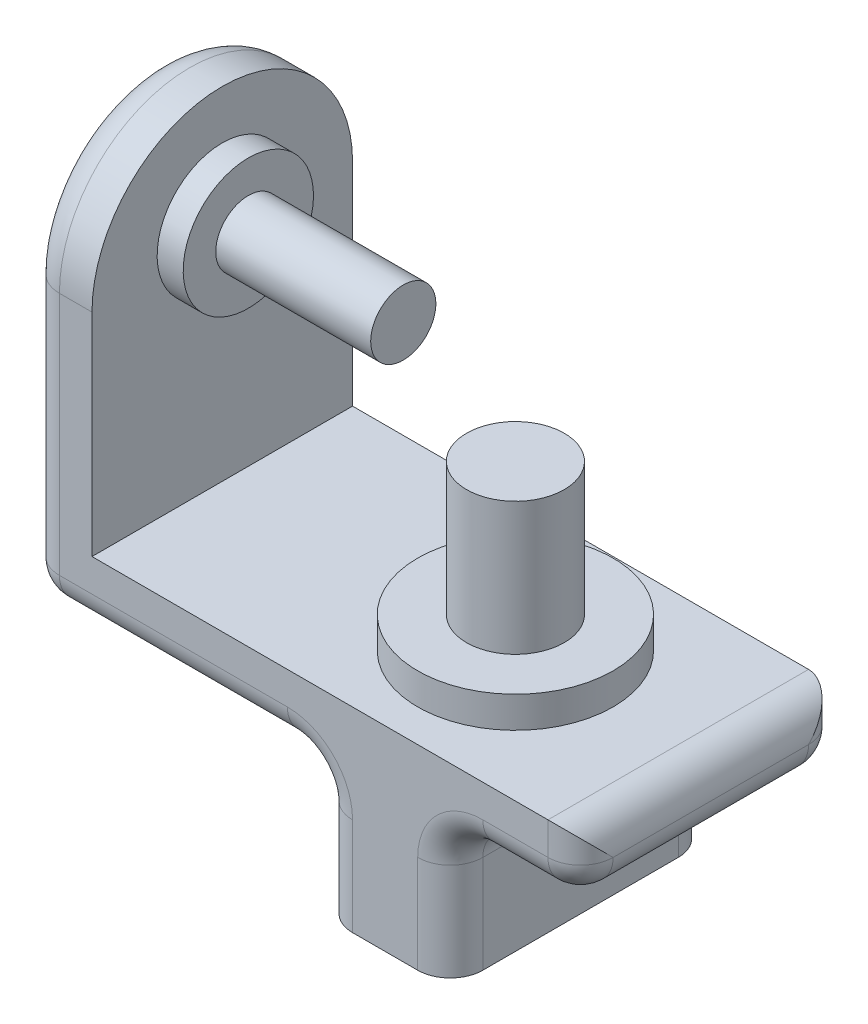
from build123d import *

# Parameters (mm, degrees)
SKETCH1_W           = 200
SKETCH1_H           = 200
BOSS_EXTRUDE1_DEPTH = 200
FILLET1_RADIUS      = 200
FILLET1_LENGTH      = 100
FILLET5_R           = 50
SKETCH2_R           = 150
SKETCH2_R_2         = 75
BOSS_EXTRUDE2_DEPTH = 48
SKETCH2_2_R         = 75
BOSS_EXTRUDE3_DEPTH = 251.487133837
SKETCH3_R           = 100
SKETCH3_R_2         = 50
BOSS_EXTRUDE4_DEPTH = 40
SKETCH3_4_R         = 50
BOSS_EXTRUDE5_DEPTH = 277.840021082
WRAP2_OUTLINE_W     = 3.419230769
WRAP2_OUTLINE_H     = 19.05
WRAP2_DEPTH         = 3


# Read off the part's stored shape, not the designer's step: Wrap2
with BuildPart() as part:
    # Sketch1 → Boss-Extrude1 (new, symmetric)
    with BuildSketch(Plane.XY):
        Polygon((-450.000101236, 475), (-450.000101236, -50), (299.999898764, -50), (299.999898764, -150), (-550.000101236, -150), (-550.000101236, 475), align=None)
        with Locations((0, -250)):
            Rectangle(SKETCH1_W, SKETCH1_H)
    extrude(amount=BOSS_EXTRUDE1_DEPTH, both=True)

    # Fillet1: full round fillet: the end face becomes a half cylinder, R = half its width
    fillet1_face = Plane((-500.000101236, 475, 0), x_dir=(1, 0, 0), z_dir=(0, 1, 0))  # on the end face: x along it, z out of the body
    fillet1_slab = fillet1_face.offset(-FILLET1_RADIUS / 2) * Box(FILLET1_LENGTH, 2 * FILLET1_RADIUS, FILLET1_RADIUS, mode=Mode.PRIVATE)  # the body's end, R deep
    fillet1_round = Plane((-500.000101236, 275, 0), x_dir=(0, 1, 0), z_dir=(1, 0, 0)) * Cylinder(FILLET1_RADIUS, FILLET1_LENGTH, mode=Mode.PRIVATE)  # its axis R under the face
    add(fillet1_slab - fillet1_round, mode=Mode.SUBTRACT)

    # Fillet5
    fillet5_edges = [part.edges().sort_by_distance(p)[0] for p in [
        (-100, -250, 200),
        (-550.000101236, -150, 0),
        (299.999898764, -150, 0),
        (299.999898764, -50, 0),
        (-550.000101236, 62.5, 200),
        (199.999949382, -150, 200),
        (-325.000050618, -150, 200),
        (299.999898764, -100, 200),
        (-550.000101236, 62.5, -200),
        (199.999949382, -150, -200),
        (-325.000050618, -150, -200),
        (299.999898764, -100, -200),
        (-550.000101236, 475, 0),
        (100, -250, 200),
        (-100, -250, -200),
        (100, -250, -200),
        (-100, -150, 0),
        (100, -150, 0),
    ]]
    fillet(fillet5_edges, radius=FILLET5_R - 0.0001)  # a hair under: the kernel refuses the full size

    # Sketch2 → Boss-Extrude2 (add)
    with BuildSketch(Plane(origin=(0, -50, 0), x_dir=(1, 0, 0), z_dir=(0, 1, 0))):
        with Locations(Location((0, 0, 0), (0, 0, 180))):
            Circle(SKETCH2_R)
        with Locations(Location((0, 0, 0), (0, 0, 180))):
            Circle(SKETCH2_R_2, mode=Mode.SUBTRACT)
    extrude(amount=BOSS_EXTRUDE2_DEPTH)

    # Sketch2<2> → Boss-Extrude3 (add)
    with BuildSketch(Plane(origin=(0, -50, 0), x_dir=(1, 0, 0), z_dir=(0, 1, 0))):
        Circle(SKETCH2_2_R)
    extrude(amount=BOSS_EXTRUDE3_DEPTH)

    # Sketch3 → Boss-Extrude4 (add)
    with BuildSketch(Plane(origin=(-450.000101236, 0, 0), x_dir=(0, 0, -1), z_dir=(1, 0, 0))):
        with Locations(Location((0, 300.000101172, 0), (0, 0, 90))):
            Circle(SKETCH3_R)
        with Locations(Location((0, 300.000101172, 0), (0, 0, 90))):
            Circle(SKETCH3_R_2, mode=Mode.SUBTRACT)
    extrude(amount=BOSS_EXTRUDE4_DEPTH)

    # Sketch3<4> → Boss-Extrude5 (add)
    with BuildSketch(Plane(origin=(-450.000101236, 0, 0), x_dir=(0, 0, -1), z_dir=(1, 0, 0))):
        with Locations(Location((0, 300.000101172, 0), (0, 0, 180))):
            Circle(SKETCH3_4_R)
    extrude(amount=BOSS_EXTRUDE5_DEPTH)

    # Wrap2 outline → Wrap2 (add)
    # profile 1 of 17: a face of its own
    with BuildSketch(Plane.ZY.offset(550.000101236)):
        with BuildLine():
            add(Edge.make_bspline(
                [(-82.804417139, 108.204415902), (-82.913939096, 108.358908009), (-83.124205981, 108.655511309), (-83.46502667, 109.05267012), (-83.804308379, 109.391476141), (-84.145194346, 109.670513999), (-84.490706056, 109.88808833), (-84.840243749, 110.042133359), (-85.1918258, 110.140061247), (-85.428034667, 110.152255625), (-85.544381081, 110.158262055)],
                knots=[0, 0, 0, 0, 0.162420307, 0.31182434, 0.448432767, 0.573381197, 0.689077147, 0.797572901, 0.900293043, 1, 1, 1, 1], degree=3))
            Line((-82.804417139, 108.204415902), (-80.247626274, 110.543688738))
            add(Edge.make_bspline(
                [(-85.506220024, 113.577492825), (-85.28176812, 113.569281896), (-84.834636057, 113.552924852), (-84.173538405, 113.425018117), (-83.527805859, 113.223871303), (-83.007462472, 112.981209802), (-82.593434952, 112.746143491), (-82.276121533, 112.529724042), (-81.95323805, 112.281803932), (-81.622180646, 112.001601899), (-81.289100883, 111.683838568), (-80.944527708, 111.336078546), (-80.593156353, 110.955316373), (-80.364820683, 110.683301642), (-80.247626274, 110.543688738)],
                knots=[0, 0, 0, 0, 0.10691022, 0.212976528, 0.319776676, 0.428556273, 0.485856803, 0.546558687, 0.611431498, 0.67982091, 0.753158505, 0.830752869, 0.913133075, 1, 1, 1, 1], degree=3))
            add(Edge.make_bspline(
                [(-90.505318581, 108.746302921), (-90.501186394, 108.909398801), (-90.493045542, 109.230715205), (-90.420427882, 109.70316416), (-90.311898022, 110.159037705), (-90.154281508, 110.596672605), (-89.949714303, 111.015520705), (-89.70127538, 111.417632443), (-89.405106952, 111.799306873), (-89.071345127, 112.160290973), (-88.703625049, 112.49018936), (-88.310669416, 112.781357742), (-87.89470239, 113.027282792), (-87.458268647, 113.231295478), (-86.99866379, 113.387454229), (-86.519273705, 113.498147335), (-86.019410796, 113.563984065), (-85.679414835, 113.572933805), (-85.506220024, 113.577492825)],
                knots=[0, 0, 0, 0, 0.06317288, 0.12445736, 0.184840915, 0.244566821, 0.304319173, 0.365199786, 0.427420983, 0.491261689, 0.555499002, 0.618604518, 0.680494764, 0.742473305, 0.804990665, 0.868251971, 0.932887217, 1, 1, 1, 1], degree=3))
            add(Edge.make_bspline(
                [(-85.704657524, 102.060485613), (-85.947131837, 102.265642133), (-86.412513435, 102.659399592), (-87.070156678, 103.240966963), (-87.662752124, 103.78449496), (-88.185181482, 104.296702776), (-88.644101312, 104.768131121), (-89.036403609, 105.202609116), (-89.357778753, 105.603488165), (-89.695956795, 106.078302572), (-90.017293549, 106.656896551), (-90.295019692, 107.353012183), (-90.475196692, 108.049039488), (-90.495383019, 108.516313884), (-90.505318581, 108.746302921)],
                knots=[0, 0, 0, 0, 0.112124581, 0.215201009, 0.309902452, 0.395959096, 0.473447494, 0.542140328, 0.602523333, 0.654726333, 0.747804055, 0.835278417, 0.918925243, 1, 1, 1, 1], degree=3))
            add(Edge.make_bspline(
                [(-83.178395504, 98.774818546), (-83.184668072, 98.883522), (-83.197410193, 99.104342662), (-83.291264731, 99.432667477), (-83.437988, 99.760842976), (-83.611571975, 100.0300214), (-83.788215404, 100.255397197), (-83.957126364, 100.45067513), (-84.162815232, 100.666423059), (-84.40476047, 100.902912379), (-84.679765351, 101.162224965), (-84.988061531, 101.444335425), (-85.333179327, 101.746758701), (-85.577109267, 101.952766449), (-85.704657524, 102.060485613)],
                knots=[0, 0, 0, 0, 0.076346606, 0.155090822, 0.238351561, 0.32840414, 0.37938386, 0.439617644, 0.509831416, 0.588874645, 0.677436354, 0.77554672, 0.882635872, 1, 1, 1, 1], degree=3))
            add(Edge.make_bspline(
                [(-85.353575793, 96.969800517), (-85.205317748, 96.975796453), (-84.917675547, 96.987429443), (-84.507103114, 97.094879864), (-84.130674762, 97.263584908), (-83.805292874, 97.50430374), (-83.529780007, 97.78212986), (-83.326435696, 98.091224121), (-83.198693429, 98.425656651), (-83.185187974, 98.657975485), (-83.178395504, 98.774818546)],
                knots=[0, 0, 0, 0, 0.141985893, 0.275473311, 0.404345843, 0.535429711, 0.661427401, 0.77786684, 0.888279749, 1, 1, 1, 1], degree=3))
            add(Edge.make_bspline(
                [(-88.475150312, 99.412108209), (-88.3641225, 99.219115306), (-88.151272695, 98.849131415), (-87.790578802, 98.352011166), (-87.421066322, 97.92630996), (-87.034192458, 97.579552096), (-86.634661452, 97.307100973), (-86.220543476, 97.112388499), (-85.791547579, 96.991861698), (-85.499335063, 96.977142592), (-85.353575793, 96.969800517)],
                knots=[0, 0, 0, 0, 0.160457921, 0.307611547, 0.442138888, 0.566229194, 0.681222208, 0.789558005, 0.895028892, 1, 1, 1, 1], degree=3))
            Line((-88.475150312, 99.412108209), (-91.482241658, 97.60709018))
            add(Edge.make_bspline(
                [(-85.479507283, 93.550569748), (-85.642435172, 93.553460197), (-85.965125831, 93.559184944), (-86.440723077, 93.605922741), (-86.899965981, 93.681352571), (-87.342337248, 93.789466051), (-87.769829838, 93.926460494), (-88.182461307, 94.093793957), (-88.577383123, 94.294060048), (-88.957583452, 94.523140498), (-89.321214052, 94.789133077), (-89.672872888, 95.086599652), (-90.00906695, 95.420115393), (-90.331410912, 95.788891547), (-90.637842325, 96.193972401), (-90.93839179, 96.629716454), (-91.219701984, 97.104210524), (-91.393479805, 97.437071952), (-91.482241658, 97.60709018)],
                knots=[0, 0, 0, 0, 0.063551482, 0.125868382, 0.18624025, 0.244976651, 0.303357688, 0.361230317, 0.418489049, 0.475936712, 0.534203744, 0.594059429, 0.655468694, 0.718771685, 0.784974607, 0.853522316, 0.925182451, 1, 1, 1, 1], degree=3))
            add(Edge.make_bspline(
                [(-79.759164735, 98.973256046), (-79.762574714, 98.780859638), (-79.769265218, 98.403370724), (-79.851211066, 97.850971929), (-79.968061036, 97.322302307), (-80.148731589, 96.823114532), (-80.368931788, 96.345214589), (-80.644984541, 95.896046638), (-80.969170648, 95.471064917), (-81.340737702, 95.077866494), (-81.751734985, 94.721066179), (-82.192568632, 94.403434111), (-82.667549336, 94.14118838), (-83.172618937, 93.925247726), (-83.707507081, 93.758927347), (-84.271576557, 93.636001086), (-84.865690147, 93.562222682), (-85.271953581, 93.554510025), (-85.479507283, 93.550569748)],
                knots=[0, 0, 0, 0, 0.065200875, 0.127926544, 0.18904691, 0.248543693, 0.307607127, 0.36724766, 0.426963056, 0.488617128, 0.550391855, 0.611330734, 0.672556085, 0.734024191, 0.797340621, 0.862249627, 0.929625466, 1, 1, 1, 1], degree=3))
            add(Edge.make_bspline(
                [(-81.728275312, 103.342697152), (-81.560093288, 103.160688182), (-81.236788375, 102.810803024), (-80.81660596, 102.268591067), (-80.470782241, 101.739281636), (-80.203246455, 101.212914918), (-80.001192668, 100.681896488), (-79.858742072, 100.133203148), (-79.773427462, 99.561101397), (-79.763955549, 99.170711791), (-79.759164735, 98.973256046)],
                knots=[0, 0, 0, 0, 0.150833097, 0.289954183, 0.417138648, 0.535255184, 0.648751095, 0.762405462, 0.879826701, 1, 1, 1, 1], degree=3))
            add(Edge.make_bspline(
                [(-84.182031322, 105.540774075), (-84.021784624, 105.402088641), (-83.717669685, 105.1388925), (-83.284974517, 104.765327838), (-82.90470753, 104.429240819), (-82.5713291, 104.135675392), (-82.28989292, 103.881551383), (-82.059215831, 103.665654082), (-81.876480502, 103.492186613), (-81.772606168, 103.387412156), (-81.728275312, 103.342697152)],
                knots=[0, 0, 0, 0, 0.192952702, 0.366184141, 0.520457298, 0.655012135, 0.770624226, 0.865677185, 0.942674527, 1, 1, 1, 1], degree=3))
            add(Edge.make_bspline(
                [(-86.769351033, 107.99834619), (-86.725540319, 107.943037227), (-86.62469384, 107.8157233), (-86.43240026, 107.614077884), (-86.190919909, 107.3670446), (-85.890960113, 107.083118197), (-85.54497303, 106.752087573), (-85.136921711, 106.386965666), (-84.678551652, 105.976445077), (-84.352752834, 105.690573404), (-84.182031322, 105.540774075)],
                knots=[0, 0, 0, 0, 0.059234189, 0.136349281, 0.233805212, 0.349411224, 0.48317915, 0.635966856, 0.809243356, 1, 1, 1, 1], degree=3))
            add(Edge.make_bspline(
                [(-87.086087812, 108.910395469), (-87.082722509, 108.831103994), (-87.075945257, 108.671421982), (-87.010486225, 108.437388107), (-86.911820772, 108.208709768), (-86.817541904, 108.069502381), (-86.769351033, 107.99834619)],
                knots=[0, 0, 0, 0, 0.241881375, 0.487115475, 0.73783784, 1, 1, 1, 1], degree=3))
            add(Edge.make_bspline(
                [(-85.544381081, 110.158262055), (-85.65290568, 110.154456105), (-85.862438166, 110.147107816), (-86.161142271, 110.074066366), (-86.426336029, 109.948007551), (-86.657760623, 109.783175044), (-86.841083045, 109.584590088), (-86.987451783, 109.37632553), (-87.069869682, 109.146448558), (-87.080717499, 108.98855978), (-87.086087812, 108.910395469)],
                knots=[0, 0, 0, 0, 0.148126258, 0.285992887, 0.416634394, 0.547379946, 0.671582838, 0.784400739, 0.893265576, 1, 1, 1, 1], degree=3))
        make_face()
    # profile 2 of 17: a face of its own
    with BuildSketch(Plane.ZY.offset(550.000101236)):
        with BuildLine():
            add(Edge.make_bspline(
                [(-54.202704399, 113.089031286), (-53.866816356, 113.086683314), (-53.217540973, 113.082144657), (-52.276869391, 113.031004906), (-51.402164523, 112.952355599), (-50.592862516, 112.844159224), (-49.85062257, 112.700985792), (-49.176401788, 112.521402782), (-48.567937325, 112.314104073), (-48.018557493, 112.070175077), (-47.517026547, 111.785778093), (-47.040806908, 111.468982685), (-46.590833621, 111.108183712), (-46.160792023, 110.710341704), (-45.756231892, 110.268178266), (-45.370415852, 109.789017224), (-45.012790432, 109.265910083), (-44.672545387, 108.711399303), (-44.364839019, 108.12313492), (-44.096446027, 107.506124118), (-43.87161159, 106.86433759), (-43.688921967, 106.19709136), (-43.543297253, 105.506600482), (-43.441406576, 104.79147161), (-43.378416744, 104.052366834), (-43.372026952, 103.551439237), (-43.36878012, 103.296903882)],
                knots=[0, 0, 0, 0, 0.060148162, 0.116267077, 0.168653955, 0.217398969, 0.262433523, 0.303932701, 0.342259967, 0.377441339, 0.411406099, 0.445398351, 0.479766387, 0.514584482, 0.550213651, 0.587000908, 0.624662987, 0.663615456, 0.703456428, 0.743450162, 0.784013386, 0.825132536, 0.867264663, 0.910306473, 0.954424205, 1, 1, 1, 1], degree=3))
            Line((-54.202704399, 113.089031286), (-58.511087812, 113.089031286))
            Line((-58.511087812, 113.089031286), (-58.511087812, 94.039031286))
            Line((-58.511087812, 94.039031286), (-54.137830601, 94.039031286))
            add(Edge.make_bspline(
                [(-43.36878012, 103.296903882), (-43.37728208, 102.937737928), (-43.394018685, 102.230698724), (-43.534998502, 101.193126837), (-43.763010601, 100.198510697), (-44.083616322, 99.254630579), (-44.481081591, 98.369891872), (-44.955898363, 97.559896574), (-45.501104718, 96.828992328), (-46.11034897, 96.180818439), (-46.770012113, 95.623704197), (-47.455535142, 95.146576619), (-48.173596298, 94.77032171), (-48.806308528, 94.531719832), (-49.354948967, 94.383330108), (-49.836649337, 94.295630351), (-50.383811808, 94.215204386), (-51.001538195, 94.153052929), (-51.687118665, 94.097629104), (-52.443285951, 94.067513954), (-53.267591801, 94.042492735), (-53.840150152, 94.040215336), (-54.137830601, 94.039031286)],
                knots=[0, 0, 0, 0, 0.065772947, 0.129477895, 0.191430088, 0.252445668, 0.311786958, 0.36881755, 0.424091518, 0.478492106, 0.531393744, 0.58200397, 0.631201271, 0.679503008, 0.705561374, 0.735221723, 0.769132486, 0.80685832, 0.848929771, 0.895116661, 0.945469804, 1, 1, 1, 1], degree=3))
        make_face()
        with BuildLine():
            add(Edge.make_bspline(
                [(-53.305919543, 97.458262055), (-53.093420408, 97.458651442), (-52.684713831, 97.459400362), (-52.094634048, 97.495072051), (-51.548959868, 97.530876591), (-51.049193405, 97.598834805), (-50.591697513, 97.674535472), (-50.182756987, 97.779883317), (-49.813941788, 97.890542304), (-49.489756921, 98.031424909), (-49.192829996, 98.189997658), (-48.91790958, 98.375784016), (-48.652534407, 98.58209276), (-48.40166588, 98.814991724), (-48.164354522, 99.071396888), (-47.942004416, 99.352629393), (-47.731647778, 99.657831191), (-47.538684063, 99.98861596), (-47.362352788, 100.341490538), (-47.205927188, 100.71303682), (-47.076227283, 101.106348987), (-46.968428663, 101.517745162), (-46.891394326, 101.950807017), (-46.827663104, 102.402326924), (-46.794807803, 102.874093766), (-46.790298618, 103.195099691), (-46.788010889, 103.357961575)],
                knots=[0, 0, 0, 0, 0.062614648, 0.120428813, 0.174199486, 0.223724664, 0.26902845, 0.310765001, 0.348115258, 0.382378114, 0.414753161, 0.447195432, 0.480044579, 0.513738641, 0.547962504, 0.582917814, 0.619315101, 0.657123545, 0.695686576, 0.735513716, 0.7758232, 0.817652262, 0.860742584, 0.905386927, 0.951998197, 1, 1, 1, 1], degree=3))
            Line((-53.305919543, 97.458262055), (-55.091857043, 97.458262055))
            Line((-55.091857043, 97.458262055), (-55.091857043, 109.669800517))
            Line((-55.091857043, 109.669800517), (-53.78674887, 109.669800517))
            add(Edge.make_bspline(
                [(-48.585396706, 108.143358209), (-48.72708622, 108.267370827), (-49.016471009, 108.520652555), (-49.524535601, 108.824148838), (-50.084396467, 109.090800071), (-50.708861548, 109.302224761), (-51.391895663, 109.469428419), (-52.137566979, 109.584744694), (-52.941882265, 109.658845709), (-53.499093154, 109.666070682), (-53.78674887, 109.669800517)],
                knots=[0, 0, 0, 0, 0.101663476, 0.207636138, 0.318744567, 0.436679942, 0.563506646, 0.698681208, 0.844446556, 1, 1, 1, 1], degree=3))
            add(Edge.make_bspline(
                [(-46.788010889, 103.357961575), (-46.792567268, 103.607532015), (-46.801451853, 104.094175036), (-46.88713287, 104.802981217), (-47.02660522, 105.470428422), (-47.225618827, 106.094039572), (-47.476481646, 106.675567345), (-47.790494942, 107.210084967), (-48.154144793, 107.706571598), (-48.441709172, 107.997826586), (-48.585396706, 108.143358209)],
                knots=[0, 0, 0, 0, 0.142276686, 0.277428514, 0.406477152, 0.530595072, 0.650142922, 0.766850697, 0.883502093, 1, 1, 1, 1], degree=3))
        make_face(mode=Mode.SUBTRACT)
    # profile 3 of 17: a face of its own
    with BuildSketch(Plane.ZY.offset(550.000101236)):
        with BuildLine():
            add(Edge.make_bspline(
                [(-28.806520504, 113.089031286), (-28.557181104, 113.08791519), (-28.076153136, 113.085762006), (-27.38247123, 113.059651792), (-26.742515707, 113.012860696), (-26.156433597, 112.955034302), (-25.62446588, 112.873963947), (-25.145946375, 112.781023132), (-24.720775777, 112.66779417), (-24.344159655, 112.533392962), (-24.006158851, 112.374939189), (-23.686301075, 112.206174609), (-23.391815148, 112.004760036), (-23.107837476, 111.792403076), (-22.850603552, 111.54881735), (-22.604065583, 111.290213843), (-22.378665127, 111.006336552), (-22.173357759, 110.700621734), (-21.987112342, 110.378717693), (-21.824395885, 110.040048959), (-21.692409408, 109.684079626), (-21.581689165, 109.313112408), (-21.492757588, 108.927163475), (-21.433561899, 108.523859206), (-21.393353209, 108.106015624), (-21.389805347, 107.821631019), (-21.388010889, 107.677793305)],
                knots=[0, 0, 0, 0, 0.070781161, 0.136551696, 0.197012482, 0.252922694, 0.303686532, 0.349719151, 0.391240471, 0.428478555, 0.463056565, 0.497150358, 0.531002334, 0.564226377, 0.59770067, 0.631421421, 0.665597347, 0.700451436, 0.735880684, 0.771092108, 0.806974845, 0.843534403, 0.880940196, 0.919294384, 0.95918024, 1, 1, 1, 1], degree=3))
            Line((-28.806520504, 113.089031286), (-32.622626274, 113.089031286))
            Line((-32.622626274, 113.089031286), (-32.622626274, 94.039031286))
            Line((-32.622626274, 94.039031286), (-29.203395504, 94.039031286))
            Line((-29.203395504, 94.039031286), (-29.203395504, 102.34287744))
            add(Edge.make_bspline(
                [(-25.322415937, 102.632901479), (-25.420072882, 102.608604273), (-25.631629273, 102.5559687), (-25.981696993, 102.502530383), (-26.385113284, 102.453397136), (-26.843182657, 102.411173059), (-27.356169197, 102.382470524), (-27.923576201, 102.360055122), (-28.545660809, 102.343756809), (-28.978233845, 102.343178474), (-29.203395504, 102.34287744)],
                knots=[0, 0, 0, 0, 0.077372749, 0.167614291, 0.272108317, 0.390015992, 0.52136331, 0.667272254, 0.826809521, 1, 1, 1, 1], degree=3))
            add(Edge.make_bspline(
                [(-21.388010889, 107.677793305), (-21.390607246, 107.518669068), (-21.395709405, 107.205970386), (-21.445727011, 106.747592483), (-21.531172884, 106.310570653), (-21.642846171, 105.891219414), (-21.798566627, 105.496438021), (-21.976469936, 105.116806872), (-22.195347436, 104.762969656), (-22.44544997, 104.430500298), (-22.718590471, 104.116695664), (-23.021253281, 103.83061627), (-23.347669517, 103.570311923), (-23.695949673, 103.333054611), (-24.067401297, 103.119322937), (-24.461756368, 102.92711553), (-24.881707767, 102.76257978), (-25.174149286, 102.676528914), (-25.322415937, 102.632901479)],
                knots=[0, 0, 0, 0, 0.068875425, 0.135348675, 0.199289315, 0.26155008, 0.322915384, 0.382771997, 0.442843572, 0.502652029, 0.562748843, 0.622739582, 0.682687332, 0.743329247, 0.805012514, 0.86806712, 0.933110571, 1, 1, 1, 1], degree=3))
        make_face()
        with BuildLine():
            add(Edge.make_bspline(
                [(-27.993689976, 105.762108209), (-27.773564956, 105.763503973), (-27.36853165, 105.766072198), (-26.815399184, 105.803210232), (-26.370891295, 105.859927512), (-26.019721808, 105.941273208), (-25.742440237, 106.064726072), (-25.503302241, 106.207537789), (-25.298187477, 106.388119284), (-25.120588281, 106.594464541), (-24.978603076, 106.831565583), (-24.880143732, 107.09556168), (-24.816186478, 107.380905992), (-24.810279432, 107.579486747), (-24.807241658, 107.681609411)],
                knots=[0, 0, 0, 0, 0.155159592, 0.285495954, 0.390502806, 0.470975045, 0.538445527, 0.60365534, 0.666587169, 0.73019895, 0.794944675, 0.860228437, 0.928120706, 1, 1, 1, 1], degree=3))
            Line((-27.993689976, 105.762108209), (-29.203395504, 105.762108209))
            Line((-29.203395504, 105.762108209), (-29.203395504, 109.669800517))
            Line((-29.203395504, 109.669800517), (-28.127253678, 109.669800517))
            add(Edge.make_bspline(
                [(-25.704026514, 109.292006046), (-25.764500976, 109.322589715), (-25.892537804, 109.387341611), (-26.110596935, 109.462620423), (-26.362233843, 109.526126395), (-26.64914736, 109.578835738), (-26.970192905, 109.619743662), (-27.3253132, 109.65102799), (-27.715030836, 109.663608637), (-27.986056133, 109.66767963), (-28.127253678, 109.669800517)],
                knots=[0, 0, 0, 0, 0.08210116, 0.173824981, 0.278953094, 0.396639095, 0.527315592, 0.671298143, 0.82875438, 1, 1, 1, 1], degree=3))
            add(Edge.make_bspline(
                [(-24.807241658, 107.681609411), (-24.810248184, 107.770832653), (-24.816081567, 107.943947194), (-24.858935184, 108.193794416), (-24.927231523, 108.426703568), (-25.026190293, 108.640242223), (-25.15412055, 108.834047543), (-25.310093423, 109.008043183), (-25.492107472, 109.165955406), (-25.63263296, 109.249540758), (-25.704026514, 109.292006046)],
                knots=[0, 0, 0, 0, 0.137787685, 0.267341238, 0.390444331, 0.511777883, 0.629508981, 0.747829066, 0.87188531, 1, 1, 1, 1], degree=3))
        make_face(mode=Mode.SUBTRACT)
    # profile 4 of 17: a face of its own
    with BuildSketch(Plane.ZY.offset(550.000101236)):
        with BuildLine():
            add(Edge.make_bspline(
                [(73.770402572, 113.089031286), (74.019741973, 113.08791519), (74.500769941, 113.085762006), (75.194451847, 113.059651792), (75.83440737, 113.012860696), (76.42048948, 112.955034302), (76.952457197, 112.873963947), (77.430976702, 112.781023132), (77.8561473, 112.66779417), (78.232763422, 112.533392962), (78.570764226, 112.374939189), (78.890622002, 112.206174609), (79.185107929, 112.004760036), (79.469085601, 111.792403076), (79.726319525, 111.54881735), (79.972857494, 111.290213843), (80.19825795, 111.006336552), (80.403565318, 110.700621734), (80.589810735, 110.378717693), (80.752527192, 110.040048959), (80.884513669, 109.684079626), (80.995233912, 109.313112408), (81.084165489, 108.927163475), (81.143361178, 108.523859206), (81.183569868, 108.106015624), (81.18711773, 107.821631019), (81.188912188, 107.677793305)],
                knots=[0, 0, 0, 0, 0.070781161, 0.136551696, 0.197012482, 0.252922694, 0.303686532, 0.349719151, 0.391240471, 0.428478555, 0.463056565, 0.497150358, 0.531002334, 0.564226377, 0.59770067, 0.631421421, 0.665597347, 0.700451436, 0.735880684, 0.771092108, 0.806974845, 0.843534403, 0.880940196, 0.919294384, 0.95918024, 1, 1, 1, 1], degree=3))
            Line((73.770402572, 113.089031286), (69.954296803, 113.089031286))
            Line((69.954296803, 113.089031286), (69.954296803, 94.039031286))
            Line((69.954296803, 94.039031286), (73.373527572, 94.039031286))
            Line((73.373527572, 94.039031286), (73.373527572, 102.34287744))
            add(Edge.make_bspline(
                [(77.25450714, 102.632901479), (77.156850195, 102.608604273), (76.945293804, 102.5559687), (76.595226084, 102.502530383), (76.191809793, 102.453397136), (75.73374042, 102.411173059), (75.22075388, 102.382470524), (74.653346875, 102.360055122), (74.031262268, 102.343756809), (73.598689232, 102.343178474), (73.373527572, 102.34287744)],
                knots=[0, 0, 0, 0, 0.077372749, 0.167614291, 0.272108317, 0.390015992, 0.52136331, 0.667272254, 0.826809521, 1, 1, 1, 1], degree=3))
            add(Edge.make_bspline(
                [(81.188912188, 107.677793305), (81.186315831, 107.518669068), (81.181213672, 107.205970386), (81.131196066, 106.747592483), (81.045750193, 106.310570653), (80.934076906, 105.891219414), (80.77835645, 105.496438021), (80.60045314, 105.116806872), (80.381575641, 104.762969656), (80.131473107, 104.430500298), (79.858332606, 104.116695664), (79.555669796, 103.83061627), (79.22925356, 103.570311923), (78.880973404, 103.333054611), (78.50952178, 103.119322937), (78.115166708, 102.92711553), (77.69521531, 102.76257978), (77.402773791, 102.676528914), (77.25450714, 102.632901479)],
                knots=[0, 0, 0, 0, 0.068875425, 0.135348675, 0.199289315, 0.26155008, 0.322915384, 0.382771997, 0.442843572, 0.502652029, 0.562748843, 0.622739582, 0.682687332, 0.743329247, 0.805012514, 0.86806712, 0.933110571, 1, 1, 1, 1], degree=3))
        make_face()
        with BuildLine():
            add(Edge.make_bspline(
                [(74.583233101, 105.762108209), (74.803358121, 105.763503973), (75.208391427, 105.766072198), (75.761523893, 105.803210232), (76.206031782, 105.859927512), (76.557201269, 105.941273208), (76.83448284, 106.064726072), (77.073620836, 106.207537789), (77.2787356, 106.388119284), (77.456334796, 106.594464541), (77.59832, 106.831565583), (77.696779345, 107.09556168), (77.760736599, 107.380905992), (77.766643645, 107.579486747), (77.769681419, 107.681609411)],
                knots=[0, 0, 0, 0, 0.155159592, 0.285495954, 0.390502806, 0.470975045, 0.538445527, 0.60365534, 0.666587169, 0.73019895, 0.794944675, 0.860228437, 0.928120706, 1, 1, 1, 1], degree=3))
            Line((74.583233101, 105.762108209), (73.373527572, 105.762108209))
            Line((73.373527572, 105.762108209), (73.373527572, 109.669800517))
            Line((73.373527572, 109.669800517), (74.449669399, 109.669800517))
            add(Edge.make_bspline(
                [(76.872896563, 109.292006046), (76.812422101, 109.322589715), (76.684385273, 109.387341611), (76.466326142, 109.462620423), (76.214689234, 109.526126395), (75.927775717, 109.578835738), (75.606730172, 109.619743662), (75.251609877, 109.65102799), (74.861892241, 109.663608637), (74.590866944, 109.66767963), (74.449669399, 109.669800517)],
                knots=[0, 0, 0, 0, 0.08210116, 0.173824981, 0.278953094, 0.396639095, 0.527315592, 0.671298143, 0.82875438, 1, 1, 1, 1], degree=3))
            add(Edge.make_bspline(
                [(77.769681419, 107.681609411), (77.766674893, 107.770832653), (77.76084151, 107.943947194), (77.717987893, 108.193794416), (77.649691554, 108.426703568), (77.550732784, 108.640242223), (77.422802526, 108.834047543), (77.266829654, 109.008043183), (77.084815605, 109.165955406), (76.944290117, 109.249540758), (76.872896563, 109.292006046)],
                knots=[0, 0, 0, 0, 0.137787685, 0.267341238, 0.390444331, 0.511777883, 0.629508981, 0.747829066, 0.87188531, 1, 1, 1, 1], degree=3))
        make_face(mode=Mode.SUBTRACT)
    # profile 5 of 17: a face of its own
    with BuildSketch(Plane.ZY.offset(550.000101236)):
        with BuildLine():
            add(Edge.make_bspline(
                [(119.121003534, 113.089031286), (119.384345675, 113.088096573), (119.890826791, 113.086298855), (120.621144896, 113.057935639), (121.292042512, 113.018465894), (121.904512961, 112.958234017), (122.45829422, 112.878373829), (122.953941306, 112.784231881), (123.391439732, 112.676936949), (123.774479193, 112.543238998), (124.120153366, 112.392429736), (124.442369753, 112.219147129), (124.748236927, 112.025320733), (125.035710496, 111.805850452), (125.307288673, 111.564684501), (125.563483806, 111.301580123), (125.800675621, 111.014306301), (126.017395417, 110.704678242), (126.214918066, 110.378956625), (126.38948666, 110.03669423), (126.531446131, 109.677653038), (126.656882541, 109.30702197), (126.747230324, 108.919502782), (126.810065885, 108.518868039), (126.856071625, 108.103707464), (126.858716735, 107.821665802), (126.860066034, 107.677793305)],
                knots=[0, 0, 0, 0, 0.072889027, 0.14018613, 0.202277434, 0.258895132, 0.310482942, 0.357095244, 0.398513567, 0.435037511, 0.469251486, 0.502805028, 0.536210446, 0.56937936, 0.602801475, 0.636665798, 0.670928657, 0.705803, 0.741189061, 0.776304311, 0.812004301, 0.847968976, 0.884521761, 0.921974159, 0.960198176, 1, 1, 1, 1], degree=3))
            Line((119.121003534, 113.089031286), (115.136989111, 113.089031286))
            Line((115.136989111, 113.089031286), (115.136989111, 94.039031286))
            Line((115.136989111, 94.039031286), (118.55621988, 94.039031286))
            Line((118.55621988, 94.039031286), (118.55621988, 102.34287744))
            Line((118.55621988, 102.34287744), (119.716316034, 102.34287744))
            Line((119.716316034, 102.34287744), (123.91403238, 94.039031286))
            Line((123.91403238, 94.039031286), (127.714873726, 94.039031286))
            Line((127.714873726, 94.039031286), (123.31871988, 102.732120229))
            add(Edge.make_bspline(
                [(126.860066034, 107.677793305), (126.85656104, 107.527623469), (126.849688385, 107.233167791), (126.812668528, 106.800636414), (126.745007859, 106.386820648), (126.642525931, 105.992932093), (126.524736267, 105.614068347), (126.368106228, 105.257219683), (126.191333749, 104.917196254), (125.981386239, 104.598807821), (125.750979105, 104.29498234), (125.483020454, 104.017360493), (125.194869891, 103.751021156), (124.870329424, 103.512646923), (124.523705099, 103.286119788), (124.148109854, 103.080825877), (123.745994952, 102.891604575), (123.463288263, 102.786081705), (123.31871988, 102.732120229)],
                knots=[0, 0, 0, 0, 0.068741263, 0.134789088, 0.19853605, 0.260385651, 0.320961578, 0.37990385, 0.438502936, 0.496154344, 0.554265483, 0.612748761, 0.672513443, 0.733646402, 0.796789619, 0.861935699, 0.929397735, 1, 1, 1, 1], degree=3))
        make_face()
        with BuildLine():
            add(Edge.make_bspline(
                [(119.888040794, 105.762108209), (120.050866971, 105.763942067), (120.362644114, 105.767453511), (120.811020594, 105.783741042), (121.218253371, 105.822985945), (121.586091238, 105.872570413), (121.916385123, 105.929822842), (122.206188921, 106.011869049), (122.459968065, 106.099783636), (122.674715264, 106.209038663), (122.858190336, 106.333285325), (123.016609318, 106.474432621), (123.14764453, 106.637792644), (123.255493194, 106.818925973), (123.339387729, 107.019434688), (123.400624312, 107.237117656), (123.434846506, 107.474454568), (123.438783886, 107.638249354), (123.440835265, 107.723586575)],
                knots=[0, 0, 0, 0, 0.105539996, 0.202086415, 0.290684899, 0.37055261, 0.442670262, 0.507674928, 0.565573203, 0.616454666, 0.663331357, 0.708862024, 0.7534118, 0.798515011, 0.845064321, 0.893873119, 0.944707806, 1, 1, 1, 1], degree=3))
            Line((119.888040794, 105.762108209), (118.55621988, 105.762108209))
            Line((118.55621988, 105.762108209), (118.55621988, 109.669800517))
            Line((118.55621988, 109.669800517), (119.72013214, 109.669800517))
            add(Edge.make_bspline(
                [(123.440835265, 107.723586575), (123.436956946, 107.824546737), (123.429338708, 108.022864266), (123.353742117, 108.30837197), (123.233408673, 108.572628883), (123.068464481, 108.814441029), (122.860738715, 109.026430248), (122.622357009, 109.213300434), (122.348174511, 109.361063394), (122.09430215, 109.458526269), (121.863337643, 109.516839313), (121.654899461, 109.560293677), (121.413526792, 109.591091032), (121.139037413, 109.62375711), (120.832131005, 109.644939407), (120.491134746, 109.660398262), (120.117027974, 109.666723239), (119.856240023, 109.668745223), (119.72013214, 109.669800517)],
                knots=[0, 0, 0, 0, 0.06376896, 0.125262305, 0.185413583, 0.246806762, 0.309422389, 0.372532682, 0.437733251, 0.505749517, 0.544013263, 0.588369599, 0.640389019, 0.697897401, 0.763271619, 0.834978604, 0.913873656, 1, 1, 1, 1], degree=3))
        make_face(mode=Mode.SUBTRACT)
    # profile 6 of 17: a face of its own
    with BuildSketch(Plane.ZY.offset(550.000101236)):
        Polygon((-128.727433966, 94.039031286), (-136.420703197, 113.089031286), (-139.591887091, 113.089031286), (-147.288972428, 94.039031286), (-143.640775312, 94.039031286), (-142.160126274, 97.946723594), (-133.860096226, 97.946723594), (-132.379447187, 94.039031286), align=None)
        Polygon((-135.153756081, 101.365954363), (-140.862650312, 101.365954363), (-138.008203197, 107.979265661), align=None, mode=Mode.SUBTRACT)
    # profile 7 of 17: a face of its own
    with BuildSketch(Plane.ZY.offset(550.000101236)):
        Polygon((-116.237319783, 94.039031286), (-112.119741658, 94.039031286), (-119.56878012, 104.663069748), (-112.779927956, 113.089031286), (-117.095943581, 113.089031286), (-122.499549351, 106.38413345), (-122.499549351, 113.089031286), (-125.91878012, 113.089031286), (-125.91878012, 94.039031286), (-122.499549351, 94.039031286), (-122.499549351, 102.972534892), align=None)
    # profile 8 of 17: a face of its own
    with BuildSketch(Plane.ZY.offset(550.000101236)):
        Polygon((-96.47752411, 94.039031286), (-92.825510889, 94.039031286), (-100.51878012, 113.089031286), (-103.689964014, 113.089031286), (-111.387049351, 94.039031286), (-107.738852235, 94.039031286), (-106.258203197, 97.946723594), (-97.958173149, 97.946723594), align=None)
        Polygon((-99.251833004, 101.365954363), (-104.960727235, 101.365954363), (-102.10628012, 107.979265661), align=None, mode=Mode.SUBTRACT)
    # profile 9 of 17: a face of its own
    with BuildSketch(Plane.ZY.offset(550.000101236)):
        Polygon((-66.326472428, 94.039031286), (-62.907241658, 94.039031286), (-62.907241658, 113.089031286), (-66.326472428, 113.089031286), (-66.326472428, 105.762108209), (-72.920703197, 105.762108209), (-72.920703197, 113.089031286), (-76.339933966, 113.089031286), (-76.339933966, 94.039031286), (-72.920703197, 94.039031286), (-72.920703197, 102.34287744), (-66.326472428, 102.34287744), align=None)
    # profile 10 of 17: a face of its own
    with BuildSketch(Plane.ZY.offset(550.000101236)):
        with Locations((-38.728395504, 103.564031286)):
            Rectangle(WRAP2_OUTLINE_W, WRAP2_OUTLINE_H)
    # profile 11 of 17: a face of its own
    with BuildSketch(Plane.ZY.offset(550.000101236)):
        Polygon((6.41231964, 94.039031286), (9.873527572, 94.039031286), (6.652734303, 113.089031286), (3.13810089, 113.089031286), (-1.238972428, 99.801350998), (-5.585516899, 113.089031286), (-9.134495264, 113.089031286), (-12.351472428, 94.039031286), (-8.886448389, 94.039031286), (-6.85628012, 106.071212777), (-2.918058966, 94.039031286), (0.417217476, 94.039031286), (4.378335265, 106.071212777), align=None)
    # profile 12 of 17: a face of its own
    with BuildSketch(Plane.ZY.offset(550.000101236)):
        Polygon((26.126322044, 94.039031286), (29.778335265, 94.039031286), (22.085066034, 113.089031286), (18.91388214, 113.089031286), (11.216796803, 94.039031286), (14.864993919, 94.039031286), (16.345642957, 97.946723594), (24.645673005, 97.946723594), align=None)
        Polygon((23.352013149, 101.365954363), (17.643118919, 101.365954363), (20.497566034, 107.979265661), align=None, mode=Mode.SUBTRACT)
    # profile 13 of 17: a face of its own
    with BuildSketch(Plane.ZY.offset(550.000101236)):
        Polygon((42.600450649, 94.039031286), (46.019681419, 94.039031286), (46.019681419, 113.089031286), (42.600450649, 113.089031286), (42.600450649, 105.762108209), (36.00621988, 105.762108209), (36.00621988, 113.089031286), (32.586989111, 113.089031286), (32.586989111, 94.039031286), (36.00621988, 94.039031286), (36.00621988, 102.34287744), (42.600450649, 102.34287744), align=None)
    # profile 14 of 17: a face of its own
    with BuildSketch(Plane.ZY.offset(550.000101236)):
        Polygon((63.493629736, 94.039031286), (67.145642957, 94.039031286), (59.452373726, 113.089031286), (56.281189832, 113.089031286), (48.584104496, 94.039031286), (52.232301611, 94.039031286), (53.712950649, 97.946723594), (62.012980697, 97.946723594), align=None)
        Polygon((60.719320842, 101.365954363), (55.010426611, 101.365954363), (57.864873726, 107.979265661), align=None, mode=Mode.SUBTRACT)
    # profile 15 of 17: a face of its own
    with BuildSketch(Plane.ZY.offset(550.000101236)):
        Polygon((97.685937428, 94.039031286), (101.337950649, 94.039031286), (93.644681419, 113.089031286), (90.473497524, 113.089031286), (82.776412188, 94.039031286), (86.424609303, 94.039031286), (87.905258342, 97.946723594), (96.20528839, 97.946723594), align=None)
        Polygon((94.911628534, 101.365954363), (89.202734303, 101.365954363), (92.057181419, 107.979265661), align=None, mode=Mode.SUBTRACT)
    # profile 16 of 17: a face of its own
    with BuildSketch(Plane.ZY.offset(550.000101236)):
        Polygon((105.611989111, 94.039031286), (109.03121988, 94.039031286), (109.03121988, 109.669800517), (112.450450649, 109.669800517), (112.450450649, 113.089031286), (102.192758342, 113.089031286), (102.192758342, 109.669800517), (105.611989111, 109.669800517), align=None)
    # profile 17 of 17: a face of its own
    with BuildSketch(Plane.ZY.offset(550.000101236)):
        Polygon((143.601322044, 94.039031286), (147.253335265, 94.039031286), (139.560066034, 113.089031286), (136.38888214, 113.089031286), (128.691796803, 94.039031286), (132.339993919, 94.039031286), (133.820642957, 97.946723594), (142.120673005, 97.946723594), align=None)
        Polygon((140.827013149, 101.365954363), (135.118118919, 101.365954363), (137.972566034, 107.979265661), align=None, mode=Mode.SUBTRACT)
    extrude(amount=WRAP2_DEPTH)


solid = part.part
